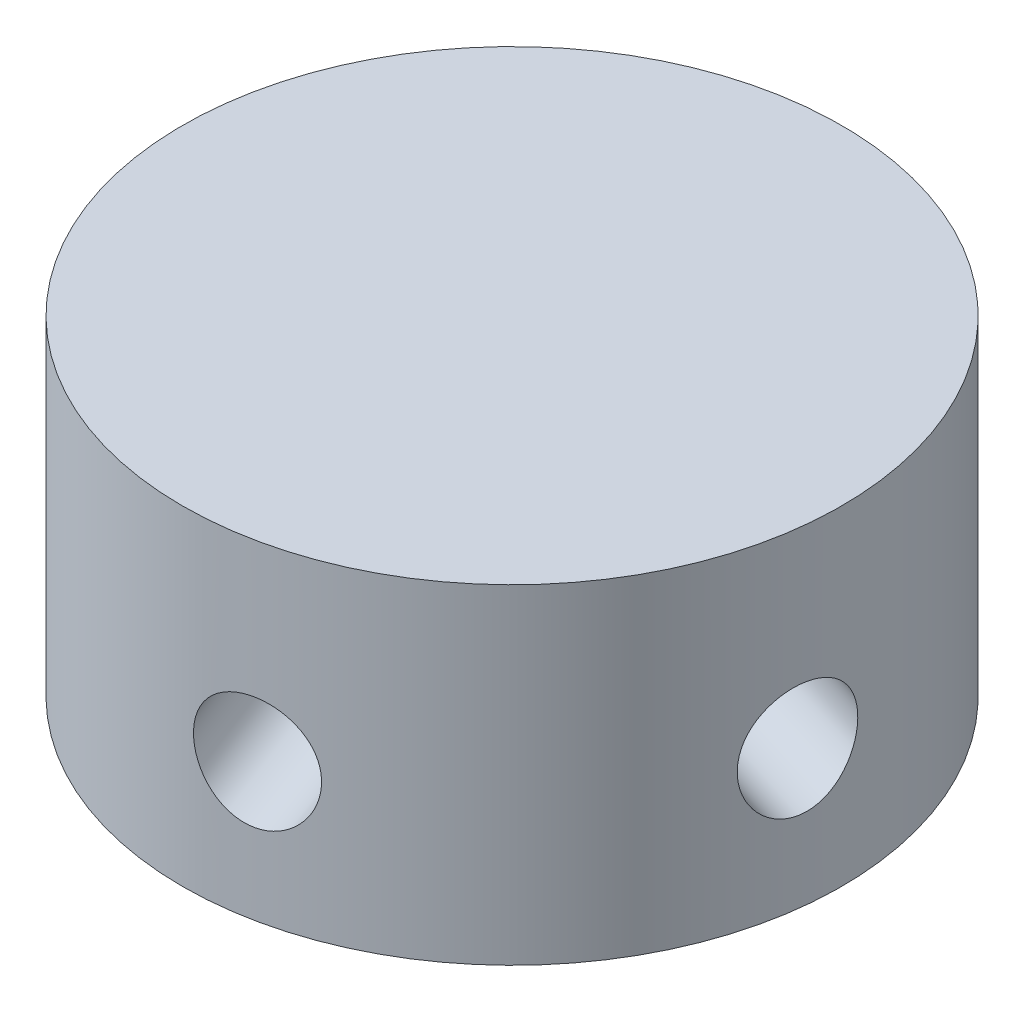
from build123d import *

# Parameters (mm, degrees)
BOSS_EXTRUDE1_DEPTH      = 3
BOSS_EXTRUDE1_DEPTH_BACK = 7
SKETCH1_R                = 10
SKETCH4_R                = 1.65
HOLE_DEPTH               = 19.828402711
HOLECIR_COUNT            = 5


with BuildPart() as part:
    # Sketch1 → Boss-Extrude1 (new, two sides: drawn at the far end of the back side and taken through both)
    with BuildSketch(Plane(origin=(0, 0, 0), x_dir=(1, 0, 0), z_dir=(0, 1, 0)).offset(-BOSS_EXTRUDE1_DEPTH_BACK)):
        Circle(SKETCH1_R)
    extrude(amount=BOSS_EXTRUDE1_DEPTH + BOSS_EXTRUDE1_DEPTH_BACK)

    # Sketch4 → hole (cut, through all)
    with BuildSketch(Plane(origin=(-3.352872105, -1.093066116, 1.887711608), x_dir=(-0.4486862613641547, -0.14627571033740308, -0.8816371449912632), z_dir=(0.8382180262940947, 0.2732665289126682, -0.47192790187872385))):
        Circle(SKETCH4_R)
    hole = extrude(amount=-HOLE_DEPTH, mode=Mode.SUBTRACT)

    # holecir: hole ×5 about axis
    holecir_axis = Axis((0, 5.5, 0), (0, -1, 0))
    for i in range(1, HOLECIR_COUNT):
        add(hole.rotate(holecir_axis, i * 360 / HOLECIR_COUNT), mode=Mode.SUBTRACT)


solid = part.part
